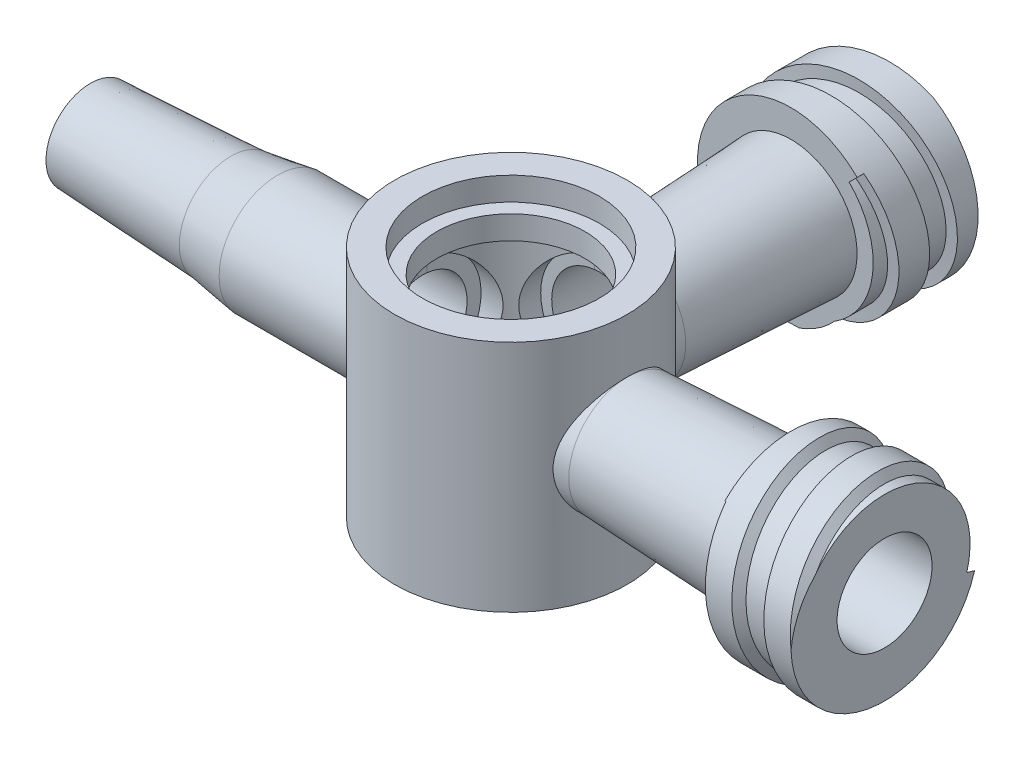
from build123d import *

# Parameters (mm, degrees)
SKETCH2_R                = 4.975
BOSS_EXTRUDE1_DEPTH      = 10
SKETCH26_R               = 2.5
CUT_EXTRUDE9_DEPTH       = 15.958379759
CUT_EXTRUDE10_REACH      = 16.958
CUT_EXTRUDE10_END_RADIUS = 2.5
SKETCH27_R               = 2.5
SKETCH28_R               = 2.5
BOSS_EXTRUDE15_DEPTH     = 1.2
BOSS_EXTRUDE16_START     = -1.2
SKETCH29_R               = 2.5
BOSS_EXTRUDE16_DEPTH     = 1.2
SKETCH30_R               = 2.5
BOSS_EXTRUDE17_DEPTH     = 1.2
BOSS_EXTRUDE18_START     = 5
SKETCH31_R               = 2.5
BOSS_EXTRUDE18_DEPTH     = 5
SKETCH55_R               = 2.825
SKETCH4_R                = 2.5
SKETCH56_R               = 2.825
SKETCH28_2_R             = 2.5
SKETCH34_R               = 2.2
SKETCH48_R               = 1.9
SKETCH35_R               = 2.2
SKETCH40_R               = 4
SKETCH40_R_2             = 2.03
BOSS_EXTRUDE22_DEPTH     = 4
SKETCH23_R               = 3.78
CUT_EXTRUDE13_DEPTH      = 24.801286898
SKETCH50_R               = 1.9
CUT_EXTRUDE15_DEPTH      = 38.363125263
SKETCH57_R               = 4
BOSS_EXTRUDE28_DEPTH     = 4
CUT_SWEEP2_PITCH         = 2.5
CUT_SWEEP3_PITCH         = 2.5
CUT_EXTRUDE23_REACH      = 31.36
SKETCH113_R              = 2.03
BOSS_EXTRUDE32_START     = -1
SKETCH115_R              = 3.78
SKETCH115_R_2            = 3.169641924
BOSS_EXTRUDE32_DEPTH     = 1
SKETCH117_R              = 3.78
SKETCH117_R_2            = 3.169641924
BOSS_EXTRUDE33_DEPTH     = 1


with BuildPart() as part:
    # Sketch2 → Boss-Extrude1 (new body)
    with BuildSketch(Plane(origin=(0, 0, 0), x_dir=(1, 0, 0), z_dir=(0, 1, 0))):
        with Locations(Location((0, 0, 0), (0, 0, 270))):
            Circle(SKETCH2_R)
    extrude(amount=-BOSS_EXTRUDE1_DEPTH)

    # Sketch26 → Cut-Extrude9 (cut, through all)
    with BuildSketch(Plane.ZY.offset(4.975)):
        with Locations((0, -4.815682957)):
            Circle(SKETCH26_R)
    extrude(amount=-CUT_EXTRUDE9_DEPTH, mode=Mode.SUBTRACT)

    # Cut-Extrude10: up to this cylinder (the profile starts outside it)
    cut_extrude10_end = Plane(origin=(0, -4.815682957, 0), z_dir=(-1, 0, 0)) * Cylinder(CUT_EXTRUDE10_END_RADIUS, 39.916, mode=Mode.PRIVATE)
    # Sketch27 → Cut-Extrude10 (cut, up to the surface)
    with BuildSketch(Plane(origin=(0, 0, -4.975), x_dir=(-1, 0, 0), z_dir=(0, 0, -1)), mode=Mode.PRIVATE) as cut_extrude10_sk1:
        with Locations((0, -4.815682957)):
            Circle(SKETCH27_R)
    cut_extrude10_tool1 = extrude(cut_extrude10_sk1.sketch, amount=-CUT_EXTRUDE10_REACH, mode=Mode.PRIVATE) - cut_extrude10_end
    add(cut_extrude10_tool1.solids().sort_by_distance((0, -4.815683, -4.975))[0], mode=Mode.SUBTRACT)

    # Sketch28 → Boss-Extrude15 (add)
    with BuildSketch(Plane(origin=(0, 0, -4.975), x_dir=(-1, 0, 0), z_dir=(0, 0, -1))):
        with Locations((0, -4.815682957)):
            Circle(SKETCH28_R)
    extrude(amount=-BOSS_EXTRUDE15_DEPTH)

    # Sketch29 → Boss-Extrude16 (add)
    with BuildSketch(Plane(origin=(4.975, 0, 0), x_dir=(0, 0, -1), z_dir=(1, 0, 0)).offset(BOSS_EXTRUDE16_START)):
        with Locations(Location((0, -4.815682957, 0), (0, 0, 180))):
            Circle(SKETCH29_R)
    extrude(amount=BOSS_EXTRUDE16_DEPTH)

    # Sketch30 → Boss-Extrude17 (add)
    with BuildSketch(Plane.ZY.offset(4.975)):
        with Locations((0, -4.815682957)):
            Circle(SKETCH30_R)
    extrude(amount=-BOSS_EXTRUDE17_DEPTH)

    # Sketch31 → Boss-Extrude18 (add)
    with BuildSketch(Plane.ZY.offset(4.975).offset(BOSS_EXTRUDE18_START)):
        with Locations((0, -4.815682957)):
            Circle(SKETCH31_R)
    extrude(amount=-BOSS_EXTRUDE18_DEPTH)

    # Sketch55 → Loft3 section 0
    with BuildSketch(Plane(origin=(11.975, 0, 0), x_dir=(0, 0, -1), z_dir=(1, 0, 0))):
        with Locations((0, -4.815682957)):
            Circle(SKETCH55_R)
    # Sketch4 → Loft3 section 1
    with BuildSketch(Plane(origin=(4.975, 0, 0), x_dir=(0, 0, -1), z_dir=(1, 0, 0))):
        with Locations((0, -4.815682957)):
            Circle(SKETCH4_R)
    loft()

    # Sketch56 → Loft4 section 0
    with BuildSketch(Plane(origin=(0, 0, -11.975), x_dir=(-1, 0, 0), z_dir=(0, 0, -1))):
        with Locations((0, -4.815682957)):
            Circle(SKETCH56_R)
    # Sketch28<2> → Loft4 section 1
    with BuildSketch(Plane(origin=(0, 0, -4.975), x_dir=(-1, 0, 0), z_dir=(0, 0, -1))):
        with Locations((0, -4.815682957)):
            Circle(SKETCH28_2_R)
    loft()

    # Sketch34 → section 1 of loft1
    with BuildSketch(Plane.ZY.offset(11.975), mode=Mode.PRIVATE) as loft1_s1:
        with Locations((0, -4.815682957)):
            Circle(SKETCH34_R)
    # loft up to a face of the part (loft1)
    loft([Face(Wire([part.edges().sort_by_distance((-9.975, -2.993261389, -1.711367765))[0]])), loft1_s1.sketch])

    # Sketch48 → Loft2 section 0
    with BuildSketch(Plane.ZY.offset(17.975)):
        with Locations((0, -4.815682957)):
            Circle(SKETCH48_R)
    # Sketch35 → Loft2 section 1
    with BuildSketch(Plane.ZY.offset(11.975)):
        with Locations((0, -4.815682957)):
            Circle(SKETCH35_R)
    loft()

    # Sketch40 → Boss-Extrude22 (add)
    with BuildSketch(Plane(origin=(11.975, 0, 0), x_dir=(0, 0, -1), z_dir=(1, 0, 0))):
        with Locations((0, -4.815682957)):
            Circle(SKETCH40_R)
        with Locations((0, -4.815682957)):
            Circle(SKETCH40_R_2, mode=Mode.SUBTRACT)
    extrude(amount=BOSS_EXTRUDE22_DEPTH)

    # Sketch23 → Cut-Extrude13 (cut, through all)
    with BuildSketch(Plane.XZ.offset(10)):
        with Locations(Location((0, 0, 0), (0, 0, 270))):
            Circle(SKETCH23_R)
    extrude(amount=-CUT_EXTRUDE13_DEPTH, mode=Mode.SUBTRACT)

    # Sketch50 → Cut-Extrude15 (cut, through all)
    with BuildSketch(Plane.ZY.offset(17.975)):
        with Locations((0, -4.815682957)):
            Circle(SKETCH50_R)
    extrude(amount=-CUT_EXTRUDE15_DEPTH, mode=Mode.SUBTRACT)

    # Sketch57 → Boss-Extrude28 (add)
    with BuildSketch(Plane(origin=(0, 0, -11.975), x_dir=(-1, 0, 0), z_dir=(0, 0, -1))):
        with Locations((0, -4.815682957)):
            Circle(SKETCH57_R)
    extrude(amount=BOSS_EXTRUDE28_DEPTH)

    # Cut-Sweep2: arcs per turn and ends read off the stored shape
    # Cut-Sweep2: the profile of Sketch106 screwed along a right-hand helix through 3 turns, 10 arcs to a turn; built about Z, then put on its axis
    cut_sweep2_z = Axis((0, 0, 0), (0, 0, 1))
    cut_sweep2_corners = [(4.815682957, 0, -3.546439569), (3.656177591, 0, -3.546439569), (3.656177591, 0, -2.441052595), (4.815682957, 0, -1.548078517)]
    with BuildLine(mode=Mode.PRIVATE) as cut_sweep2_profile:
        Line(cut_sweep2_corners[0], cut_sweep2_corners[1])
        Line(cut_sweep2_corners[1], cut_sweep2_corners[2])
        Line(cut_sweep2_corners[2], cut_sweep2_corners[3])
        Line(cut_sweep2_corners[3], cut_sweep2_corners[0])
    cut_sweep2_cap = Face(cut_sweep2_profile.wire())
    cut_sweep2_turn_angles = [0, 18, 36, 54, 72, 90, 108, 126, 144, 162, 180, 198, 216, 234, 252, 270, 288, 306, 324, 342, 360]
    cut_sweep2_turn_weights = [1, 0.9510565162951535, 1, 0.9510565162951535, 1, 0.9510565162951535, 1, 0.9510565162951535, 1, 0.9510565162951535, 1, 0.9510565162951535, 1, 0.9510565162951535, 1, 0.9510565162951535, 1, 0.9510565162951535, 1, 0.9510565162951535, 1]
    cut_sweep2_turn_rails = [Edge.make_bspline([Vector(p[0], p[1], 0).rotate(cut_sweep2_z, cut_sweep2_turn_angles[k]) / cut_sweep2_turn_weights[k] + Vector(0, 0, p[2] + CUT_SWEEP2_PITCH * cut_sweep2_turn_angles[k] / 360) for k in range(21)], [0, 0, 0, 1, 1, 2, 2, 3, 3, 4, 4, 5, 5, 6, 6, 7, 7, 8, 8, 9, 9, 10, 10, 10], 2, cut_sweep2_turn_weights) for p in cut_sweep2_corners]
    cut_sweep2_turn_sides = [Face.make_surface_from_curves(cut_sweep2_turn_rails[p[0]], cut_sweep2_turn_rails[p[1]]) for p in [(0, 1), (1, 2), (2, 3), (3, 0)]]
    cut_sweep2 = Plane(origin=(15.975, -4.815682957, 0), x_dir=(0, 0.7071067811865438, 0.7071067811865512), z_dir=(-1, 0, 0)) * Solid(Shell([*[p.moved(Location((0, 0, CUT_SWEEP2_PITCH * i))) for i in range(3) for p in cut_sweep2_turn_sides], cut_sweep2_cap, cut_sweep2_cap.rotate(cut_sweep2_z, 1080).moved(Location((0, 0, CUT_SWEEP2_PITCH * 1080 / 360)))]))
    add(cut_sweep2, mode=Mode.SUBTRACT)

    # Cut-Sweep3: arcs per turn and ends read off the stored shape
    # Cut-Sweep3: the profile of Sketch111 screwed along a right-hand helix through 2 turns, 10 arcs to a turn; built about Z, then put on its axis
    cut_sweep3_z = Axis((0, 0, 0), (0, 0, 1))
    cut_sweep3_corners = [(4.815682957, 0, -1.283528037), (3.513793139, 0, -1.283528037), (3.513793139, 0, -0.283528037), (4.815682957, 0, 0.216471963)]
    with BuildLine(mode=Mode.PRIVATE) as cut_sweep3_profile:
        Line(cut_sweep3_corners[0], cut_sweep3_corners[1])
        Line(cut_sweep3_corners[1], cut_sweep3_corners[2])
        Line(cut_sweep3_corners[2], cut_sweep3_corners[3])
        Line(cut_sweep3_corners[3], cut_sweep3_corners[0])
    cut_sweep3_cap = Face(cut_sweep3_profile.wire())
    cut_sweep3_turn_angles = [0, 18, 36, 54, 72, 90, 108, 126, 144, 162, 180, 198, 216, 234, 252, 270, 288, 306, 324, 342, 360]
    cut_sweep3_turn_weights = [1, 0.9510565162951535, 1, 0.9510565162951535, 1, 0.9510565162951535, 1, 0.9510565162951535, 1, 0.9510565162951535, 1, 0.9510565162951535, 1, 0.9510565162951535, 1, 0.9510565162951535, 1, 0.9510565162951535, 1, 0.9510565162951535, 1]
    cut_sweep3_turn_rails = [Edge.make_bspline([Vector(p[0], p[1], 0).rotate(cut_sweep3_z, cut_sweep3_turn_angles[k]) / cut_sweep3_turn_weights[k] + Vector(0, 0, p[2] + CUT_SWEEP3_PITCH * cut_sweep3_turn_angles[k] / 360) for k in range(21)], [0, 0, 0, 1, 1, 2, 2, 3, 3, 4, 4, 5, 5, 6, 6, 7, 7, 8, 8, 9, 9, 10, 10, 10], 2, cut_sweep3_turn_weights) for p in cut_sweep3_corners]
    cut_sweep3_turn_sides = [Face.make_surface_from_curves(cut_sweep3_turn_rails[p[0]], cut_sweep3_turn_rails[p[1]]) for p in [(0, 1), (1, 2), (2, 3), (3, 0)]]
    cut_sweep3 = Plane(origin=(0, -4.815682957, -15.975), x_dir=(0.7071067811865512, 0.7071067811865438, 0), z_dir=(0, 0, 1)) * Solid(Shell([*[p.moved(Location((0, 0, CUT_SWEEP3_PITCH * i))) for i in range(2) for p in cut_sweep3_turn_sides], cut_sweep3_cap, cut_sweep3_cap.rotate(cut_sweep3_z, 720).moved(Location((0, 0, CUT_SWEEP3_PITCH * 720 / 360)))]))
    add(cut_sweep3, mode=Mode.SUBTRACT)

    # Sketch113 → Cut-Extrude23 (cut, up to next)
    with BuildSketch(Plane(origin=(0, 0, -15.975), x_dir=(-1, 0, 0), z_dir=(0, 0, -1)), mode=Mode.PRIVATE) as cut_extrude23_sk1:
        with Locations((0, -4.831921259)):
            Circle(SKETCH113_R)
    cut_extrude23_tool1 = extrude(cut_extrude23_sk1.sketch, amount=-CUT_EXTRUDE23_REACH, mode=Mode.PRIVATE) & part.part
    add(cut_extrude23_tool1.solids().sort_by_distance((0, -4.831921, -15.975))[0], mode=Mode.SUBTRACT)

    # Sketch115 → Boss-Extrude32 (add)
    with BuildSketch(Plane(origin=(0, -8, 0), x_dir=(1, 0, 0), z_dir=(0, 1, 0)).offset(BOSS_EXTRUDE32_START)):
        with Locations(Location((0, 0, 0), (0, 0, 90))):
            Circle(SKETCH115_R)
        with Locations(Location((0, 0, 0), (0, 0, 270))):
            Circle(SKETCH115_R_2, mode=Mode.SUBTRACT)
    extrude(amount=BOSS_EXTRUDE32_DEPTH)

    # Sketch117 → Boss-Extrude33 (add)
    with BuildSketch(Plane(origin=(0, -2, 0), x_dir=(1, 0, 0), z_dir=(0, 1, 0))):
        with Locations(Location((0, 0, 0), (0, 0, 270))):
            Circle(SKETCH117_R)
        with Locations(Location((0, 0, 0), (0, 0, 270))):
            Circle(SKETCH117_R_2, mode=Mode.SUBTRACT)
    extrude(amount=BOSS_EXTRUDE33_DEPTH)


solid = part.part
